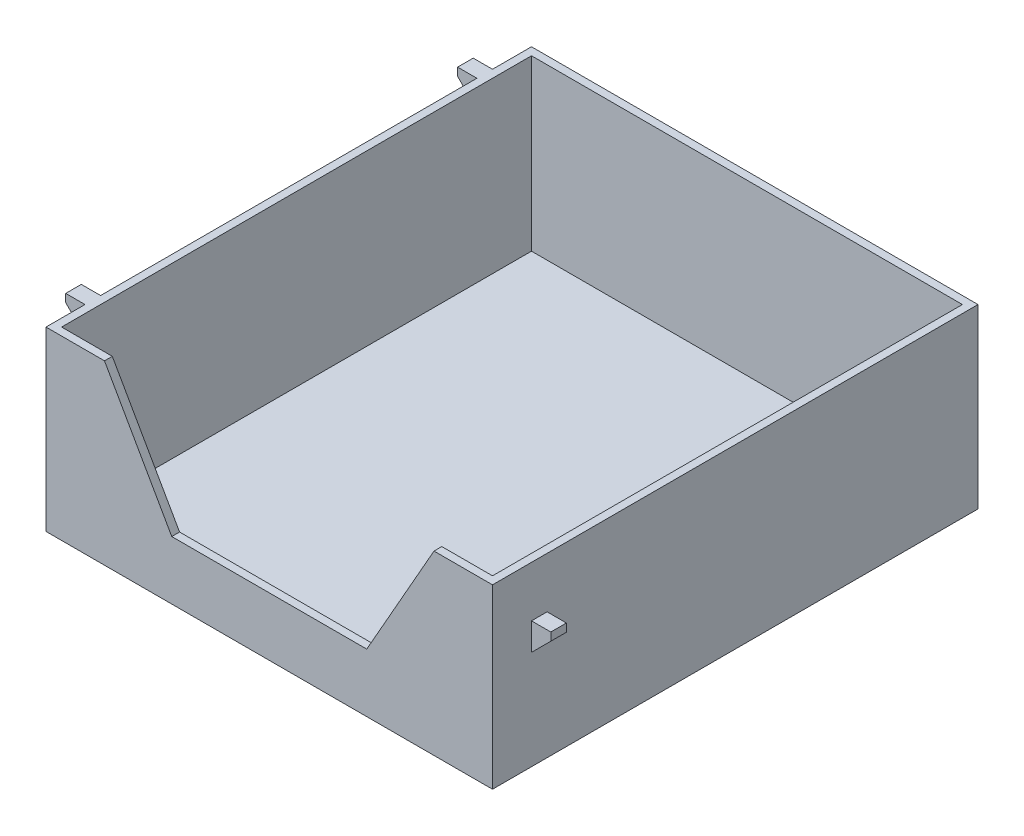
from build123d import *

# Parameters (mm, degrees)
ESBO_O1_W                = 114.5
ESBO_O1_H                = 124.5
RESSALTO_EXTRUS_O1_DEPTH = 2
ESBO_O2_W                = 114.5
ESBO_O2_H                = 45.4
RESSALTO_EXTRUS_O2_DEPTH = 2
RESSALTO_EXTRUS_O3_DEPTH = 2
ESBO_O4_W                = 124.5
ESBO_O4_H                = 45.4
RESSALTO_EXTRUS_O4_DEPTH = 2
ESBO_O5_W                = 124.5
ESBO_O5_H                = 45.4
RESSALTO_EXTRUS_O5_DEPTH = 2
RESSALTO_EXTRUS_O6_START = -10
RESSALTO_EXTRUS_O6_DEPTH = 4
RESSALTO_EXTRUS_O7_START = -10
RESSALTO_EXTRUS_O7_DEPTH = 4
RESSALTO_EXTRUS_O8_START = -10
RESSALTO_EXTRUS_O8_DEPTH = 4


with BuildPart() as part:
    # Esboço1 → Ressalto-extrusão1 (new body)
    with BuildSketch(Plane(origin=(0, 0, 0), x_dir=(1, 0, 0), z_dir=(0, 1, 0))):
        Rectangle(ESBO_O1_W, ESBO_O1_H)
    extrude(amount=RESSALTO_EXTRUS_O1_DEPTH)

    # Esboço2 → Ressalto-extrusão2 (add)
    with BuildSketch(Plane(origin=(0, 0, -62.25), x_dir=(-1, 0, 0), z_dir=(0, 0, -1))):
        with Locations((0, 22.7)):
            Rectangle(ESBO_O2_W, ESBO_O2_H)
    extrude(amount=-RESSALTO_EXTRUS_O2_DEPTH)

    # Esboço3 → Ressalto-extrusão3 (add)
    with BuildSketch(Plane.XY.offset(62.25)):
        Polygon((-42.25, 45.4), (-25, 15), (25, 15), (42.25, 45.4), (57.25, 45.4), (57.25, 0), (-57.25, 0), (-57.25, 45.4), align=None)
    extrude(amount=-RESSALTO_EXTRUS_O3_DEPTH)

    # Esboço4 → Ressalto-extrusão4 (add)
    with BuildSketch(Plane.ZY.offset(57.25)):
        with Locations((0, 22.7)):
            Rectangle(ESBO_O4_W, ESBO_O4_H)
    extrude(amount=-RESSALTO_EXTRUS_O4_DEPTH)

    # Esboço5 → Ressalto-extrusão5 (add)
    with BuildSketch(Plane(origin=(57.25, 0, 0), x_dir=(0, 0, -1), z_dir=(1, 0, 0))):
        with Locations((0, 22.7)):
            Rectangle(ESBO_O5_W, ESBO_O5_H)
    extrude(amount=-RESSALTO_EXTRUS_O5_DEPTH)

    # Esboço6 → Ressalto-extrusão6 (add)
    with BuildSketch(Plane.XY.offset(62.25).offset(RESSALTO_EXTRUS_O6_START)):
        Polygon((57.25, 25.4), (62.199747468, 30.349747468), (62.199747468, 32.4), (57.25, 32.4), align=None)
    extrude(amount=-RESSALTO_EXTRUS_O6_DEPTH)

    # Esboço8 → Ressalto-extrusão7 (add)
    with BuildSketch(Plane.XY.offset(62.25).offset(RESSALTO_EXTRUS_O7_START)):
        Polygon((-57.25, 38.4), (-62.199747468, 43.349747468), (-62.199747468, 45.4), (-57.25, 45.4), align=None)
    extrude(amount=-RESSALTO_EXTRUS_O7_DEPTH)

    # Esboço10 → Ressalto-extrusão8 (add)
    with BuildSketch(Plane(origin=(0, 0, -62.25), x_dir=(-1, 0, 0), z_dir=(0, 0, -1)).offset(RESSALTO_EXTRUS_O8_START)):
        Polygon((57.25, 45.4), (57.25, 38.4), (62.199747468, 43.349747468), (62.199747468, 45.4), align=None)
    extrude(amount=-RESSALTO_EXTRUS_O8_DEPTH)


solid = part.part
